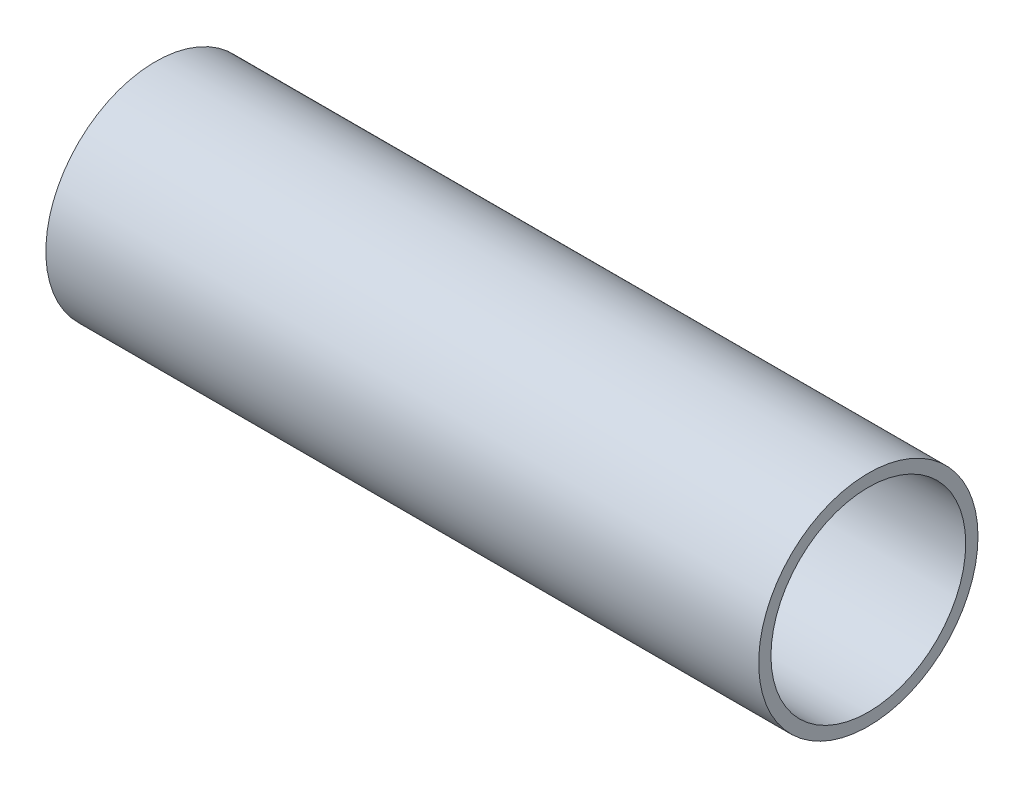
from build123d import *

# Parameters (mm, degrees)
SKETCH1_R           = 6.35
SKETCH1_R_2         = 5.6388
BOSS_EXTRUDE1_DEPTH = 41.275


with BuildPart() as part:
    # Sketch1 → Boss-Extrude1 (new body)
    with BuildSketch(Plane(origin=(0, 0, 0), x_dir=(0, 0, -1), z_dir=(1, 0, 0))):
        Circle(SKETCH1_R)
        Circle(SKETCH1_R_2, mode=Mode.SUBTRACT)
    extrude(amount=BOSS_EXTRUDE1_DEPTH)


solid = part.part
